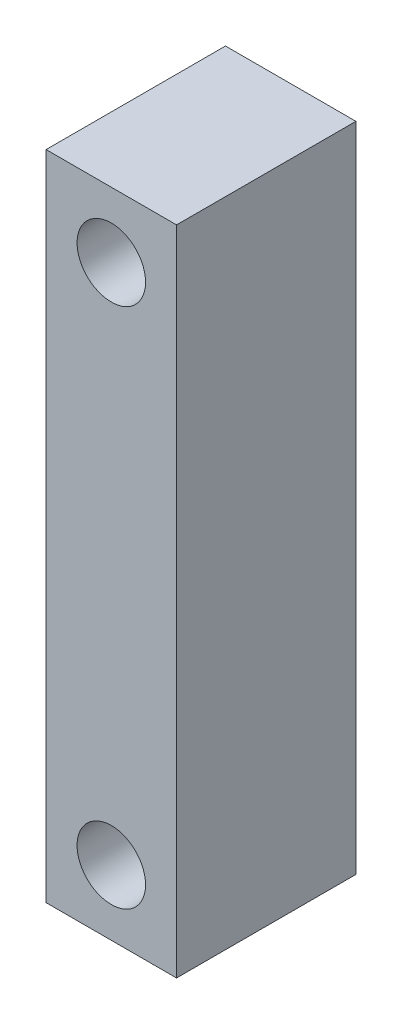
from build123d import *

# Parameters (mm, degrees)
SKETCH_1_W          = 4
SKETCH_1_H          = 20
EXTRUDE_1_DEPTH     = 5.5
SKETCH_2_R          = 1.05
CUT_EXTRUDE_1_DEPTH = 12.586630226


with BuildPart() as part:
    # ｽｹｯﾁ1 → ﾎﾞｽ - 押し出し1 (new body)
    with BuildSketch(Plane.XY):
        Rectangle(SKETCH_1_W, SKETCH_1_H)
    extrude(amount=EXTRUDE_1_DEPTH)

    # ｽｹｯﾁ2 → ｶｯﾄ - 押し出し1 (cut, through all)
    with BuildSketch(Plane.XY.offset(5.5)):
        with Locations((0, 8)):
            Circle(SKETCH_2_R)
        with Locations((0, -8)):
            Circle(SKETCH_2_R)
    extrude(amount=-CUT_EXTRUDE_1_DEPTH, mode=Mode.SUBTRACT)


solid = part.part
